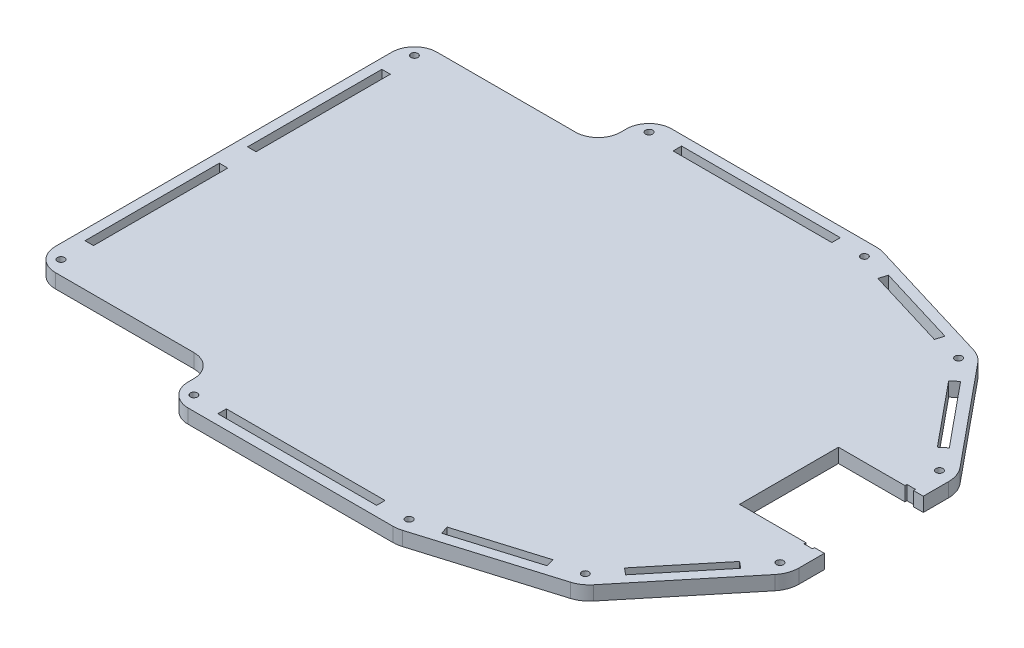
from build123d import *

# Parameters (mm, degrees)
ESTRUSIONE_ESTRUSIONE1_DEPTH  = 5
FORO_FILETTATO_M3X0_5_1_D     = 2.5
FORO_FILETTATO_M3X0_5_1_DEPTH = 7.5
FORO_FILETTATO_M3X0_5_1_TIP   = 0.751075774
SCHIZZO4_W                    = 56.133863436
SCHIZZO4_H                    = 3
TAGLIO_ESTRUSIONE2_DEPTH      = 10
SCHIZZO7_W                    = 3
SCHIZZO7_H                    = 47.5
TAGLIO_ESTRUSIONE5_DEPTH      = 10
TAGLIO_ESTRUSIONE1_DEPTH      = 246.428706552
TAGLIO_ESTRUSIONE1_DEPTH_BACK = 246.428706552
RACCORDO1_R                   = 8
SCHIZZO11_W                   = 3
SCHIZZO11_H                   = 0.709483211
TAGLIO_ESTRUSIONE7_DEPTH      = 5
RACCORDO2_R                   = 10


with BuildPart() as part:
    # Schizzo1 → Estrusione-Estrusione1 (new body)
    with BuildSketch(Plane(origin=(0, 0, 0), x_dir=(1, 0, 0), z_dir=(0, 1, 0))):
        Polygon((65, 67.5), (65, 85.5), (146.875093985, 85.5), (196.850087732, 70.349849699), (230, 30), (230, -30), (196.850087732, -70.349849699), (146.875093985, -85.5), (65, -85.5), (65, -67.5), (0, -67.5), (0, 67.5), align=None)
    extrude(amount=ESTRUSIONE_ESTRUSIONE1_DEPTH)

    # Foro filettato M3x0.5-1
    with Locations(Plane(origin=(0, 5, 0), x_dir=(1, 0, 0), z_dir=(0, 1, 0))):
        with Locations((193.948924143, 66.004643382), (225, 28.209483211), (225, -28.209483211), (193.948924143, -66.004643382), (146.133863436, -80.5), (146.133863436, 80.5), (70, 80.5), (70, -80.5), (5, -62.5), (5, 62.5)):
            Hole(FORO_FILETTATO_M3X0_5_1_D / 2, depth=FORO_FILETTATO_M3X0_5_1_DEPTH)
            with Locations((0, 0, -(FORO_FILETTATO_M3X0_5_1_DEPTH + FORO_FILETTATO_M3X0_5_1_TIP / 2))):  # 118° drill point
                Cone(0, FORO_FILETTATO_M3X0_5_1_D / 2, FORO_FILETTATO_M3X0_5_1_TIP, mode=Mode.SUBTRACT)

    # Schizzo4 → Taglio-Estrusione2 (cut)
    with BuildSketch(Plane(origin=(0, 5, 0), x_dir=(1, 0, 0), z_dir=(0, 1, 0))):
        with Locations((108.066931718, -80.5)):
            Rectangle(SCHIZZO4_W, SCHIZZO4_H)
        Polygon((217.492975754, 34.984037585), (199.13792159, 57.325685754), (201.45594839, 59.230089008), (219.811002554, 36.888440839), align=None)
        with Locations((108.066931718, 80.5)):
            Rectangle(SCHIZZO4_W, SCHIZZO4_H)
        Polygon((184.814184898, 70.341294038), (156.138951758, 79.034323479), (155.268602682, 76.163349344), (183.943835821, 67.470319903), align=None)
        Polygon((155.268602682, -76.163349344), (183.943835821, -67.470319903), (184.814184898, -70.341294038), (156.138951758, -79.034323479), align=None)
        Polygon((199.13792159, -57.325685754), (217.492975754, -34.984037585), (219.811002554, -36.888440839), (201.45594839, -59.230089008), align=None)
    extrude(amount=-TAGLIO_ESTRUSIONE2_DEPTH, mode=Mode.SUBTRACT)

    # Schizzo7 → Taglio-Estrusione5 (cut)
    with BuildSketch(Plane(origin=(0, 5, 0), x_dir=(1, 0, 0), z_dir=(0, 1, 0))):
        with Locations((5, 28.75)):
            Rectangle(SCHIZZO7_W, SCHIZZO7_H)
        with Locations((5, -28.75)):
            Rectangle(SCHIZZO7_W, SCHIZZO7_H)
    extrude(amount=-TAGLIO_ESTRUSIONE5_DEPTH, mode=Mode.SUBTRACT)

    # Schizzo2 → Taglio-Estrusione1 (cut, two sides: drawn at the far end of the back side and taken through both)
    with BuildSketch(Plane(origin=(0, 5, 0), x_dir=(1, 0, 0), z_dir=(0, 1, 0)).offset(-TAGLIO_ESTRUSIONE1_DEPTH_BACK)):
        Polygon((744.019840879, 17.5), (230, 17.5), (200, 17.5), (200, -17.5), (230, -17.5), (744.019840879, -17.5), (1772.059522638, -17.5), (1772.059522638, 17.5), align=None)
    extrude(amount=TAGLIO_ESTRUSIONE1_DEPTH + TAGLIO_ESTRUSIONE1_DEPTH_BACK, mode=Mode.SUBTRACT)

    # Raccordo1
    raccordo1_edges = [part.edges().sort_by_distance(p)[0] for p in [
        (0, 2.5, 67.5),
        (0, 2.5, -67.5),
        (65, 2.5, -85.5),
        (65, 2.5, 85.5),
        (65, 2.5, 67.5),
        (65, 2.5, -67.5),
    ]]
    fillet(raccordo1_edges, radius=RACCORDO1_R)

    # Schizzo11 → Taglio-Estrusione7 (cut)
    with BuildSketch(Plane(origin=(0, 5, 0), x_dir=(1, 0, 0), z_dir=(0, 1, 0))):
        with Locations((225, -17.854741606)):
            Rectangle(SCHIZZO11_W, SCHIZZO11_H)
        with Locations((225, 17.854741606)):
            Rectangle(SCHIZZO11_W, SCHIZZO11_H)
    extrude(amount=-TAGLIO_ESTRUSIONE7_DEPTH, mode=Mode.SUBTRACT)

    # Raccordo2
    raccordo2_edges = [part.edges().sort_by_distance(p)[0] for p in [
        (146.875093985, 2.5, -85.5),
        (196.850087732, 2.5, -70.349849699),
        (230, 2.5, -30),
        (230, 2.5, 30),
        (196.850087732, 2.5, 70.349849699),
        (146.875093985, 2.5, 85.5),
    ]]
    fillet(raccordo2_edges, radius=RACCORDO2_R)


solid = part.part
